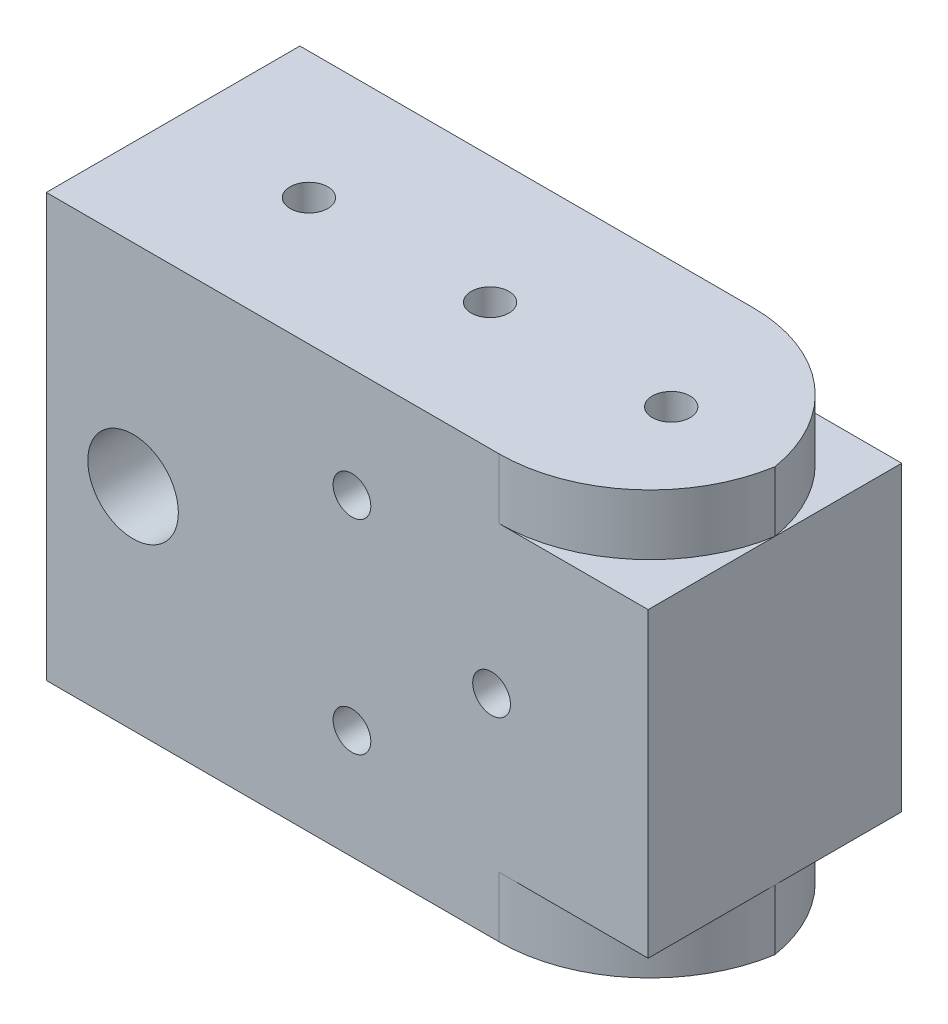
from build123d import *

# Parameters (mm, degrees)
SKETCH1_W           = 40
SKETCH1_H           = 16.8
BOSS_EXTRUDE1_DEPTH = 28
FILLET2_R           = 10
SKETCH3_W           = 9.871170143
SKETCH3_H           = 10
SKETCH3_W_2         = 30
BOSS_EXTRUDE2_DEPTH = 16.8
SKETCH2_R           = 3
SKETCH2_R_2         = 1.25
CUT_EXTRUDE1_DEPTH  = 16.8
SKETCH4_R           = 1.25
CUT_EXTRUDE2_DEPTH  = 36.419768492


with BuildPart() as part:
    # Sketch1 → Boss-Extrude1 (new body)
    with BuildSketch(Plane(origin=(0, 0, 0), x_dir=(1, 0, 0), z_dir=(0, 1, 0))):
        Rectangle(SKETCH1_W, SKETCH1_H)
    extrude(amount=BOSS_EXTRUDE1_DEPTH)

    # Fillet2
    # the kernel refuses this fillet: 10 mm, written as the material it takes off along each edge
    with BuildSketch(Plane(origin=(20, -25, -8.4), x_dir=(0, 0, 1), z_dir=(0, 1, 0)), Plane(origin=(20, -25, 8.4), x_dir=(-1, 0, 0), z_dir=(0, 1, 0))) as fillet2_piece_1:
        with BuildLine():
            CenterArc((FILLET2_R, -FILLET2_R), FILLET2_R, 90, 90)
            Line((0, -FILLET2_R), (0, 0))
            Line((0, 0), (FILLET2_R, 0))
        make_face()
    extrude(amount=78, mode=Mode.SUBTRACT)

    # Sketch3 → Boss-Extrude2 (add)
    with BuildSketch(Plane.XY.offset(8.4)):
        with Locations((14.935585072, 9)):
            Rectangle(SKETCH3_W, SKETCH3_H)
        with Locations((14.935585072, 19)):
            Rectangle(SKETCH3_W, SKETCH3_H)
        with Locations((-5, 19)):
            Rectangle(SKETCH3_W_2, SKETCH3_H)
        with Locations((-5, 9)):
            Rectangle(SKETCH3_W_2, SKETCH3_H)
    extrude(amount=-BOSS_EXTRUDE2_DEPTH)

    # Sketch2 → Cut-Extrude1 (cut)
    with BuildSketch(Plane.XY.offset(8.4)):
        with Locations((-14.25, 14)):
            Circle(SKETCH2_R)
        with Locations((9.5, 14)):
            Circle(SKETCH2_R_2)
        with Locations((0.25, 20.75)):
            Circle(SKETCH2_R_2)
        with Locations((0.25, 7.25)):
            Circle(SKETCH2_R_2)
    extrude(amount=-CUT_EXTRUDE1_DEPTH, mode=Mode.SUBTRACT)

    # Sketch4 → Cut-Extrude2 (cut, through all)
    with BuildSketch(Plane(origin=(0, 28, 0), x_dir=(1, 0, 0), z_dir=(0, 1, 0))):
        with Locations(Location((-11, 0, 0), (0, 0, 270))):
            Circle(SKETCH4_R)
        with Locations(Location((1, 0, 0), (0, 0, 270))):
            Circle(SKETCH4_R)
        with Locations(Location((13, 0, 0), (0, 0, 270))):
            Circle(SKETCH4_R)
    extrude(amount=-CUT_EXTRUDE2_DEPTH, mode=Mode.SUBTRACT)


solid = part.part
